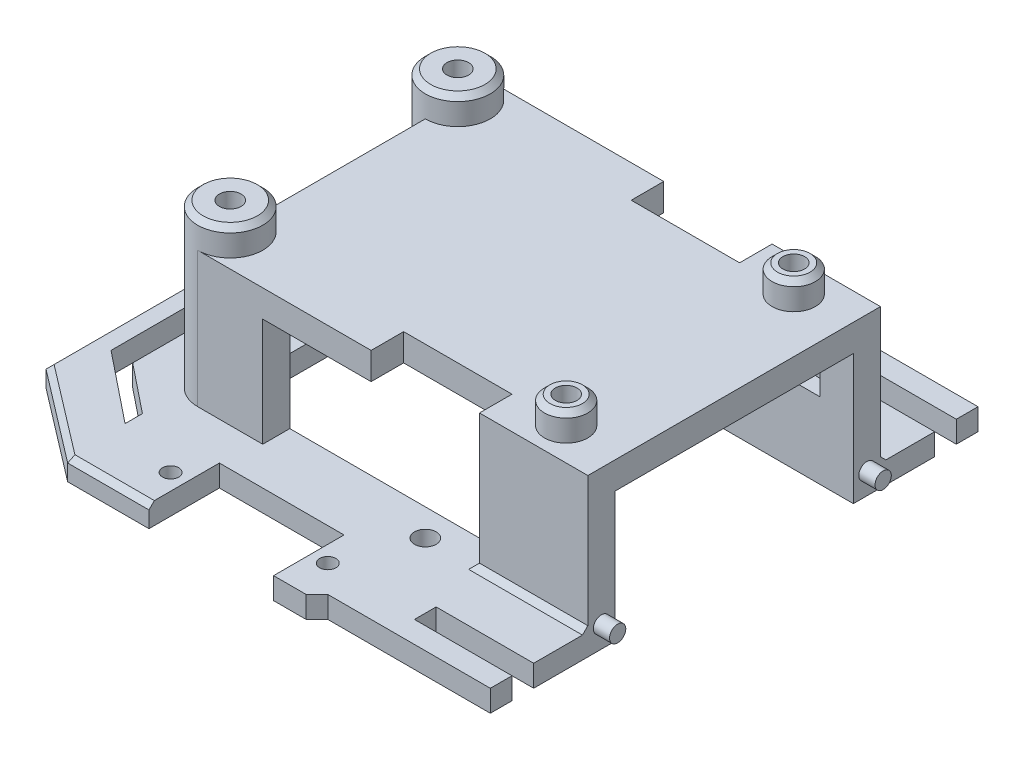
from build123d import *

# Parameters (mm, degrees)
EXTRUDE_1_DEPTH                = 4
CUT_EXTRUDE_1_DEPTH            = 105.27847333
CUT_EXTRUDE_1_DEPTH_BACK       = 105.27847333
SKETCH_2_R                     = 2
SKETCH_2_W                     = 4
SKETCH_2_H                     = 16
CHAMFER_1_SIZE                 = 1
CUT_EXTRUDE_2_DEPTH            = 105.27847333
CUT_EXTRUDE_2_DEPTH_BACK       = 105.27847333
SKETCH_6_W                     = 20
SKETCH_6_H                     = 5
EXTRUDE_2_DEPTH                = 25
CHAMFER_2_SIZE                 = 1
EXTRUDE_START                  = -5
EXTRUDE_3_DEPTH                = 5
SKETCH_8_R                     = 6
EXTRUDE_4_DEPTH                = 5
CHAMFER_3_SIZE                 = 1
SKETCH_9_R                     = 4
EXTRUDE_5_DEPTH                = 5
CUT_EXTRUDE_START              = -10
SKETCH_10_R                    = 2
CUT_EXTRUDE_3_DEPTH            = 120.608393839
HOLE_WIZARD_1_4_0_15748031_1_D = 3.999999874
SKETCH_13_R                    = 1.5
CUT_EXTRUDE_4_DEPTH            = 109.434311913
SKETCH_14_R                    = 2
CUT_EXTRUDE_5_DEPTH            = 109.434311913
CUT_EXTRUDE_START_2            = 10
SKETCH_15_R                    = 4
CUT_EXTRUDE_6_DEPTH            = 10
CHAMFER_4_SIZE                 = 2
CHAMFER_5_SIZE                 = 1
SKETCH_16_W                    = 18
SKETCH_16_H                    = 4
CUT_EXTRUDE_7_DEPTH            = 109.434311913
SKETCH_17_R                    = 1.5
EXTRUDE_6_DEPTH                = 3


with BuildPart() as part:
    # 草图1 → 凸台-拉伸1 (new body)
    with BuildSketch(Plane(origin=(0, 0, 0), x_dir=(1, 0, 0), z_dir=(0, 1, 0))):
        Polygon((0, -34), (0, 34), (17, 47), (32, 47), (32, 34), (55, 34), (55, 47), (61, 47), (63, 45), (93, 45), (93, -45), (63, -45), (61, -47), (55, -47), (55, -34), (32, -34), (32, -47), (17, -47), align=None)
    extrude(amount=EXTRUDE_1_DEPTH)

    # 草图2 → 切除-拉伸1 (cut, two sides: drawn at the far end of the back side and taken through both)
    with BuildSketch(Plane(origin=(0, 4, 0), x_dir=(1, 0, 0), z_dir=(0, 1, 0)).offset(-CUT_EXTRUDE_1_DEPTH_BACK)):
        with Locations(Location((13, 10, 0), (0, 0, 270))):
            Circle(SKETCH_2_R)
        with Locations(Location((13, -10, 0), (0, 0, 90))):
            Circle(SKETCH_2_R)
        with Locations((6, 0)):
            Rectangle(SKETCH_2_W, SKETCH_2_H)
        Polygon((4, 12), (4, 26), (17, 36.408329997), (17, 33.205766921), (8, 26), (8, 12), align=None)
        Polygon((8, -26), (8, -12), (4, -12), (4, -26), (17, -36.408329997), (17, -33.205766921), align=None)
    extrude(amount=CUT_EXTRUDE_1_DEPTH + CUT_EXTRUDE_1_DEPTH_BACK, mode=Mode.SUBTRACT)

    # 倒角1
    chamfer_1_edges = [part.edges().sort_by_distance(p)[0] for p in [
        (8.5, 4, 40.5),
        (24.5, 4, 47),
        (8.5, 4, -40.5),
        (24.5, 4, -47),
        (0, 4, 0),
    ]]
    chamfer(chamfer_1_edges, length=CHAMFER_1_SIZE)

    # 草图3 → 切除-拉伸2 (cut, two sides: drawn at the far end of the back side and taken through both)
    with BuildSketch(Plane(origin=(0, 4, 0), x_dir=(1, 0, 0), z_dir=(0, 1, 0)).offset(-CUT_EXTRUDE_2_DEPTH_BACK)):
        Polygon((93, 22), (33, 22), (21, 10), (21, -10), (33, -22), (93, -22), align=None)
    extrude(amount=CUT_EXTRUDE_2_DEPTH + CUT_EXTRUDE_2_DEPTH_BACK, mode=Mode.SUBTRACT)

    # 草图6 → 凸台-拉伸2 (add)
    with BuildSketch(Plane(origin=(0, 4, 0), x_dir=(1, 0, 0), z_dir=(0, 1, 0))):
        with BuildLine():
            Line((21, 10), (21, 15))
            ThreePointArc((21, 15), (15, 21), (21, 27))
            Line((21, 27), (33, 27))
            Line((33, 27), (33, 22))
            Line((33, 22), (21, 10))
        make_face()
        with Locations((83, 24.5)):
            Rectangle(SKETCH_6_W, SKETCH_6_H)
    extrude_2 = extrude(amount=EXTRUDE_2_DEPTH)

    # 镜向1: 凸台-拉伸2 across plane
    add(extrude_2.mirror(Plane.XY))

    # 倒角2
    chamfer_2_edges = [part.edges().sort_by_distance(p)[0] for p in [
        (83, 4, -27),
        (73, 4, -24.5),
        (83, 4, 27),
        (73, 4, 24.5),
    ]]
    chamfer(chamfer_2_edges, length=CHAMFER_2_SIZE)

    # 草图7 → 凸台-拉伸3 (add)
    with BuildSketch(Plane(origin=(0, 29, 0), x_dir=(1, 0, 0), z_dir=(0, 1, 0)).offset(EXTRUDE_START)):
        with BuildLine():
            Line((93, 22), (93, 27))
            Line((93, 27), (73, 27))
            Line((73, 27), (73, 21))
            Line((73, 21), (53, 21))
            Line((53, 21), (53, 27))
            Line((53, 27), (33, 27))
            Line((33, 27), (21, 27))
            ThreePointArc((21, 27), (15, 21), (21, 15))
            Line((21, 15), (21, 10))
            Line((21, 10), (21, -10))
            Line((21, -10), (21, -15))
            ThreePointArc((21, -15), (15, -21), (21, -27))
            Line((21, -27), (33, -27))
            Line((33, -27), (53, -27))
            Line((53, -27), (53, -21))
            Line((53, -21), (73, -21))
            Line((73, -21), (73, -27))
            Line((73, -27), (93, -27))
            Line((93, -27), (93, -22))
            Line((93, -22), (93, 22))
        make_face()
    extrude(amount=EXTRUDE_3_DEPTH)

    # 草图8 → 凸台-拉伸4 (add)
    with BuildSketch(Plane(origin=(0, 29, 0), x_dir=(1, 0, 0), z_dir=(0, 1, 0))):
        with Locations(Location((21, 21, 0), (0, 0, 270))):
            Circle(SKETCH_8_R)
        with Locations(Location((21, -21, 0), (0, 0, 270))):
            Circle(SKETCH_8_R)
    extrude(amount=EXTRUDE_4_DEPTH)

    # 倒角3
    chamfer_3_edges = [part.edges().sort_by_distance(p)[0] for p in [
        (21, 34, -27),
        (21, 34, 15),
    ]]
    chamfer(chamfer_3_edges, length=CHAMFER_3_SIZE)

    # 草图9 → 凸台-拉伸5 (add)
    with BuildSketch(Plane(origin=(0, 29, 0), x_dir=(1, 0, 0), z_dir=(0, 1, 0))):
        with Locations(Location((83, 21, 0), (0, 0, 270))):
            Circle(SKETCH_9_R)
    extrude_5 = extrude(amount=EXTRUDE_5_DEPTH)

    # 草图10 → 切除-拉伸3 (cut)
    with BuildSketch(Plane(origin=(0, 34, 0), x_dir=(1, 0, 0), z_dir=(0, 1, 0)).offset(CUT_EXTRUDE_START)):
        with Locations(Location((83, 21, 0), (0, 0, 270))):
            Circle(SKETCH_10_R)
    cut_extrude_3 = extrude(amount=CUT_EXTRUDE_3_DEPTH, mode=Mode.SUBTRACT)

    # 镜向2: 凸台-拉伸5, 切除-拉伸3 across plane
    add(extrude_5.mirror(Plane.XY))
    add(cut_extrude_3.mirror(Plane.XY), mode=Mode.SUBTRACT)

    # 1/4 (0.15748031) 直径孔1 (through all)
    with Locations(Plane(origin=(21, 34, -21), x_dir=(0, 0, 1), z_dir=(0, 1, 0))):
        with Locations((0, 0)):
            hole_wizard_1_4_0_15748031_1 = Hole(HOLE_WIZARD_1_4_0_15748031_1_D / 2)

    # 镜向3: 1/4 (0.15748031) 直径孔1 across plane
    add(hole_wizard_1_4_0_15748031_1.mirror(Plane.XY), mode=Mode.SUBTRACT)

    # 草图13 → 切除-拉伸4 (cut, symmetric)
    with BuildSketch(Plane(origin=(0, 4, 0), x_dir=(1, 0, 0), z_dir=(0, 1, 0))):
        with Locations(Location((29, 40, 0), (0, 0, 270))):
            Circle(SKETCH_13_R)
        with Locations(Location((58, 40, 0), (0, 0, 270))):
            Circle(SKETCH_13_R)
    cut_extrude_4 = extrude(amount=CUT_EXTRUDE_4_DEPTH, both=True, mode=Mode.SUBTRACT)

    # 镜向4: 切除-拉伸4 across plane
    add(cut_extrude_4.mirror(Plane.XY), mode=Mode.SUBTRACT)

    # 草图14 → 切除-拉伸5 (cut, symmetric)
    with BuildSketch(Plane(origin=(0, 4, 0), x_dir=(1, 0, 0), z_dir=(0, 1, 0))):
        with Locations(Location((63, 27, 0), (0, 0, 270))):
            Circle(SKETCH_14_R)
    cut_extrude_5 = extrude(amount=CUT_EXTRUDE_5_DEPTH, both=True, mode=Mode.SUBTRACT)

    # 镜向5: 切除-拉伸5 across plane
    add(cut_extrude_5.mirror(Plane.XY), mode=Mode.SUBTRACT)

    # 草图15 → 切除-拉伸6 (cut)
    with BuildSketch(Plane.XZ.offset(-24).offset(CUT_EXTRUDE_START_2)):
        with Locations(Location((83, 21, 0), (0, 0, 270))):
            Circle(SKETCH_15_R)
        with Locations(Location((83, -21, 0), (0, 0, 90))):
            Circle(SKETCH_15_R)
    extrude(amount=-CUT_EXTRUDE_6_DEPTH, mode=Mode.SUBTRACT)

    # 倒角4
    chamfer_4_edges = [part.edges().sort_by_distance(p)[0] for p in [
        (83, 24, -23),
        (83, 24, 23),
    ]]
    chamfer(chamfer_4_edges, length=CHAMFER_4_SIZE - 0.0001)  # a hair under: the kernel refuses the full size

    # 倒角5
    chamfer_5_edges = [part.edges().sort_by_distance(p)[0] for p in [
        (83, 34, -25),
        (83, 34, 25),
    ]]
    chamfer(chamfer_5_edges, length=CHAMFER_5_SIZE)

    # 草图16 → 切除-拉伸7 (cut, through all)
    with BuildSketch(Plane(origin=(0, 4, 0), x_dir=(1, 0, 0), z_dir=(0, 1, 0))):
        with Locations((84, 39)):
            Rectangle(SKETCH_16_W, SKETCH_16_H)
    cut_extrude_7 = extrude(amount=-CUT_EXTRUDE_7_DEPTH, mode=Mode.SUBTRACT)

    # 镜向6: 切除-拉伸7 across plane
    add(cut_extrude_7.mirror(Plane.XY), mode=Mode.SUBTRACT)

    # 草图17 → 凸台-拉伸6 (add)
    with BuildSketch(Plane(origin=(93, 0, 0), x_dir=(0, 0, -1), z_dir=(1, 0, 0))):
        with Locations(Location((24.5, 4, 0), (0, 0, 180))):
            Circle(SKETCH_17_R)
    extrude_6 = extrude(amount=EXTRUDE_6_DEPTH)

    # 镜向7: 凸台-拉伸6 across plane
    add(extrude_6.mirror(Plane.XY))


solid = part.part
